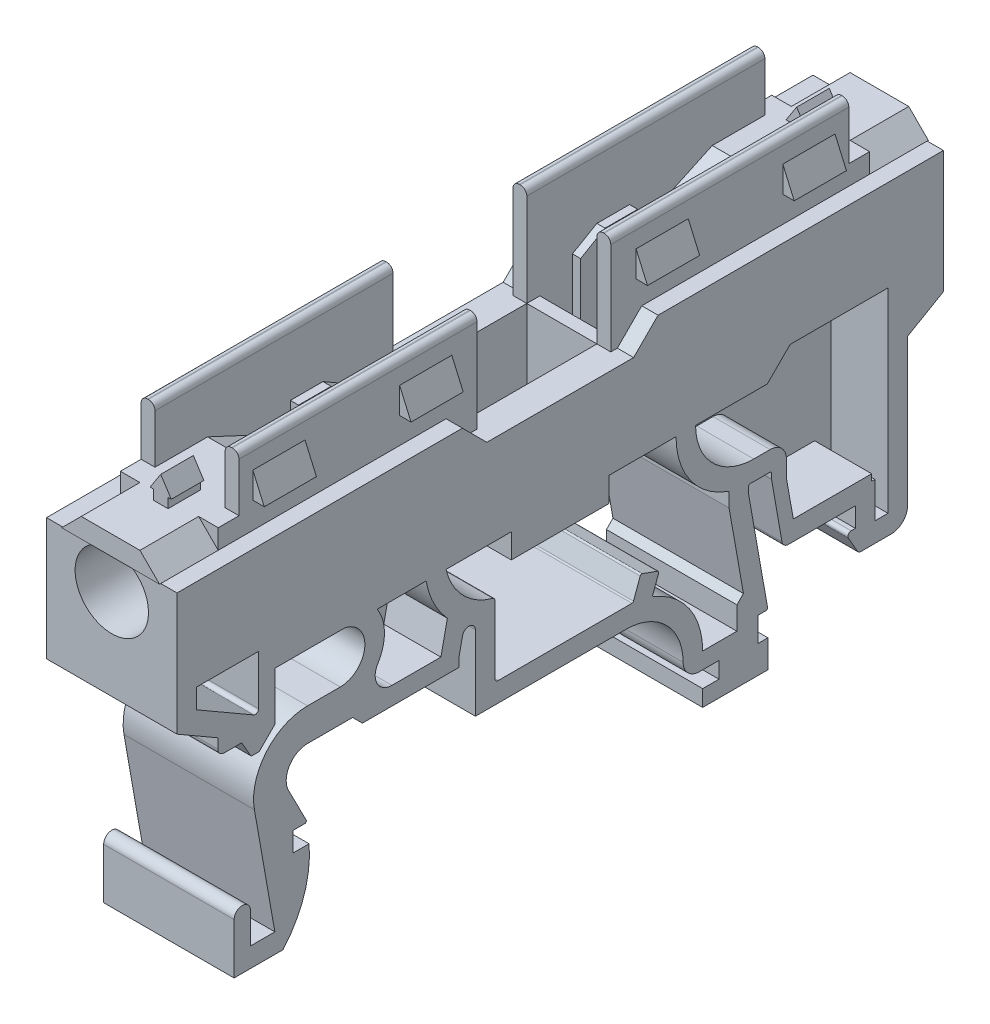
from build123d import *

# Parameters (mm, degrees)
TOPBODY_DEPTH              = 4
MIDBASE_START              = -4
MIDBASES_W                 = 6
MIDBASES_H                 = 1.5
MIDBASE_DEPTH              = 8
REARLEG_START              = -4
REARLEG_DEPTH              = 8
LEGJOINT_START             = -4
LEGJOINT_DEPTH             = 8
FRONTLEG_START             = -4
FRONTLEG_DEPTH             = 8
FRONTPOCKET_DEPTH          = 3.5
REARPOCKET_DEPTH           = 3.5
FRONTLEGFILLWALL_DEPTH     = 0.5
MIDPOCKETS_W               = 4.3
MIDPOCKETS_H               = 8.2
MIDPOCKET_DEPTH            = 4.5
LOWERCUTMIDPOCKETS_W       = 4.3
LOWERCUTMIDPOCKETS_H       = 4
LOWERCUTMIDPOCKET_DEPTH    = 1.5
INSERTPOCKETS_W            = 4.3
INSERTPOCKETS_H            = 8
INSERTPOCKET_DEPTH         = 6
INSERTPOCKETEDGES_W        = 4.3
INSERTPOCKETEDGES_H        = 0.4
INSERTPOCKETEDGE_DEPTH     = 1.5
HEADBODY_DEPTH             = 3
INSERTPOCKETENDS_W         = 2.8
INSERTPOCKETENDS_H         = 1
INSERTPOCKETEND_DEPTH      = 5.5
INSERTENDSLANTEDBODY_DEPTH = 3.6
HOLES_R                    = 2.25
HOLE_DEPTH                 = 8
WIREACCESSS_W              = 2.8
WIREACCESSS_H              = 3.52278299
WIREACCESS_DEPTH           = 2.6
LOCKINGWALL_DEPTH          = 0.85
LOCKINGTAB_DEPTH           = 3.2
LOCKINGTABLP_COUNT         = 2
LOCKINGTABLP_PITCH         = 9
LWF_R                      = 0.4
INSIDEWALL_DEPTH           = 0.5
LWHM_COPY_1_DEPTH          = 3.2
LWF_OF_LWHM_R              = 0.4
LWVM_START                 = -18.7
LWVM_DEPTH                 = 14.6
LWVM_START_2               = -10.4
LWVM_2_OUTLINE_W           = 0.5
LWVM_2_OUTLINE_H           = 6.6
LWVM_2_DEPTH               = 2
LWVM_START_3               = -17.85
LWVM_3_DEPTH               = 3.2
LWVM_START_4               = -8.85
LWVM_4_DEPTH               = 3.2
LWVM_START_5               = -2.232671
LWVM_5_DEPTH               = 0.582671
LWVM_START_6               = 1.65
LWVM_6_DEPTH               = 0.582671
LWVM_START_7               = -3
LWVM_7_DEPTH               = 0.85
LWVM_START_8               = 2.15
LWVM_8_DEPTH               = 0.85
TOPTAB_DEPTH               = 2


with BuildPart() as part:
    # TopBodyS → TopBody (new, symmetric)
    with BuildSketch(Plane(origin=(0, 0, 0), x_dir=(0, 0, -1), z_dir=(1, 0, 0))):
        with BuildLine():
            Line((-23.5, 1.5), (-6, 1.5))
            Line((-6, 1.5), (-4.5, 0))
            Line((-4.5, 0), (4.5, 0))
            Line((4.5, 0), (6, 1.5))
            Line((6, 1.5), (23.5, 1.5))
            Line((23.5, 1.5), (23.5, -5.942264973))
            ThreePointArc((23.5, -5.942264973), (23.48660254, -5.992264973), (23.45, -6.028867513))
            Line((23.45, -6.028867513), (21.3, -7.270170592))
            Line((21.3, -7.270170592), (21.3, -16.270170592))
            ThreePointArc((21.3, -16.270170592), (21.007106781, -16.977277373), (20.3, -17.270170592))
            Line((20.3, -17.270170592), (18.415470054, -17.270170592))
            ThreePointArc((18.415470054, -17.270170592), (18.315470054, -17.243375673), (18.242264973, -17.170170592))
            Line((18.242264973, -17.170170592), (17.664914704, -16.170170592))
            ThreePointArc((17.664914704, -16.170170592), (17.664914704, -15.970170592), (17.838119785, -15.870170592))
            Line((17.838119785, -15.870170592), (18.1, -15.870170592))
            Line((18.1, -15.870170592), (18.1, -14.670170592))
            Line((18.1, -14.670170592), (13.993923101, -14.670170592))
            ThreePointArc((13.993923101, -14.670170592), (13.736808057, -14.576588369), (13.6, -14.339629863))
            Line((13.6, -14.339629863), (12.959099098, -10.704900228))
            ThreePointArc((12.959099098, -10.704900228), (12.956821709, -10.687601741), (12.956060648, -10.670170592))
            Line((12.956060648, -10.670170592), (12.956060648, -10.370170592))
            ThreePointArc((12.956060648, -10.370170592), (12.926771326, -10.299459914), (12.856060648, -10.270170592))
            Line((12.856060648, -10.270170592), (11.870170592, -10.270170592))
            ThreePointArc((11.870170592, -10.270170592), (8.497150619, -8.873019973), (7.1, -5.5))
            Line((7.1, -5.5), (-17.5, -5.5))
            Line((-17.5, -5.5), (-17.5, -8.443375673))
            ThreePointArc((-17.5, -8.443375673), (-17.507612047, -8.481644016), (-17.529289322, -8.514086351))
            Line((-17.529289322, -8.514086351), (-18.429289322, -9.414086351))
            ThreePointArc((-18.429289322, -9.414086351), (-18.461731657, -9.435763626), (-18.5, -9.443375673))
            Line((-18.5, -9.443375673), (-18.9, -9.443375673))
            ThreePointArc((-18.9, -9.443375673), (-18.95, -9.429978213), (-18.98660254, -9.393375673))
            Line((-18.98660254, -9.393375673), (-19.506217783, -8.493375673))
            ThreePointArc((-19.506217783, -8.493375673), (-19.542820323, -8.456773133), (-19.592820323, -8.443375673))
            Line((-19.592820323, -8.443375673), (-20.6, -8.443375673))
            ThreePointArc((-20.6, -8.443375673), (-20.882842712, -8.326218385), (-21, -8.043375673))
            Line((-21, -8.043375673), (-21, -7.443375673))
            Line((-21, -7.443375673), (-23.5, -6))
            Line((-23.5, -6), (-23.5, 1.5))
        make_face()
    extrude(amount=TOPBODY_DEPTH, both=True)

    # MidBaseS → MidBase (add)
    with BuildSketch(Plane(origin=(0, 0, 0), x_dir=(0, 0, -1), z_dir=(1, 0, 0)).offset(MIDBASE_START)):
        with Locations((0, -6.25)):
            Rectangle(MIDBASES_W, MIDBASES_H)
    extrude(amount=MIDBASE_DEPTH)

    # RearLegS → RearLeg (add)
    with BuildSketch(Plane(origin=(0, 0, 0), x_dir=(0, 0, -1), z_dir=(1, 0, 0)).offset(REARLEG_START)):
        with BuildLine():
            Line((11.556060648, -10.810152454), (12.714966684, -17.382635182))
            ThreePointArc((12.714966684, -17.382635182), (12.693090353, -17.464278761), (12.616485908, -17.5))
            Line((12.616485908, -17.5), (12.135661267, -17.5))
            Line((12.135661267, -17.5), (12.135661267, -19))
            Line((12.135661267, -19), (12.735661267, -19))
            Line((12.735661267, -19), (12.735661267, -20.7))
            Line((12.735661267, -20.7), (8.735661267, -20.7))
            Line((8.735661267, -20.7), (8.735661267, -19.7))
            Line((8.735661267, -19.7), (9.735661267, -19.7))
            Line((9.735661267, -19.7), (9.735661267, -18.7))
            Line((9.735661267, -18.7), (8.735661267, -18.7))
            Line((8.735661267, -18.7), (8.735661267, -17.7))
            Line((8.735661267, -17.7), (10.835026164, -17.7))
            Line((10.835026164, -17.7), (10.835026164, -16.3))
            Line((10.835026164, -16.3), (11.235026164, -15.9))
            Line((11.235026164, -15.9), (10.356060648, -10.91513885))
            Line((10.356060648, -10.91513885), (10.356060648, -10.09491139))
            ThreePointArc((10.356060648, -10.09491139), (10.337651941, -10.037093911), (10.289203429, -10.000563332))
            ThreePointArc((10.289203429, -10.000563332), (10.962919155, -10.183099648), (11.656060648, -10.265362988))
            ThreePointArc((11.656060648, -10.265362988), (11.58534997, -10.29465231), (11.556060648, -10.365362988))
            Line((11.556060648, -10.365362988), (11.556060648, -10.810152454))
        make_face()
    extrude(amount=REARLEG_DEPTH)

    # LegJointS → LegJoint (add)
    with BuildSketch(Plane(origin=(0, 0, 0), x_dir=(0, 0, -1), z_dir=(1, 0, 0)).offset(LEGJOINT_START)):
        with BuildLine():
            Line((-4, -8.656042918), (-4, -12.8))
            ThreePointArc((-4, -12.8), (-3.941421356, -12.941421356), (-3.8, -13))
            Line((-3.8, -13), (4.399287288, -13))
            ThreePointArc((4.399287288, -13), (4.456644931, -12.981915204), (4.49325655, -12.934202014))
            Line((4.49325655, -12.934202014), (4.905743356, -11.800903829))
            ThreePointArc((4.905743356, -11.800903829), (4.957450792, -11.744475065), (5.033914632, -11.741136582))
            Line((5.033914632, -11.741136582), (5.973607253, -12.083156725))
            ThreePointArc((5.973607253, -12.083156725), (6.030036017, -12.134864161), (6.033374501, -12.211328001))
            Line((6.033374501, -12.211328001), (5.677001646, -13.190454373))
            ThreePointArc((5.677001646, -13.190454373), (5.679904796, -13.265971798), (5.734818624, -13.317892713))
            ThreePointArc((5.734818624, -13.317892713), (7.913549841, -15.044443521), (8.735661267, -17.7))
            Line((8.735661267, -17.7), (8.735661267, -18.7))
            Line((8.735661267, -18.7), (8.535661267, -18.7))
            ThreePointArc((8.535661267, -18.7), (7.828554486, -18.407106781), (7.535661267, -17.7))
            ThreePointArc((7.535661267, -17.7), (6.510535002, -15.225126266), (4.035661267, -14.2))
            Line((4.035661267, -14.2), (-5.2, -14.2))
            Line((-5.2, -14.2), (-5.2, -9.614111458))
            ThreePointArc((-5.2, -9.614111458), (-5.259875742, -9.403599014), (-5.421577446, -9.256109513))
            ThreePointArc((-5.421577446, -9.256109513), (-7.269893266, -7.711644965), (-8.223973273, -5.5))
            Line((-8.223973273, -5.5), (-7, -5.5))
            ThreePointArc((-7, -5.5), (-5.983838809, -7.376158966), (-4.147718297, -8.462997267))
            ThreePointArc((-4.147718297, -8.462997267), (-4.041166218, -8.534503502), (-4, -8.656042918))
        make_face()
    extrude(amount=LEGJOINT_DEPTH)

    # FrontLegS → FrontLeg (add)
    with BuildSketch(Plane(origin=(0, 0, 0), x_dir=(0, 0, -1), z_dir=(1, 0, 0)).offset(FRONTLEG_START)):
        with BuildLine():
            Line((-13.491109447, -8.5), (-15.491109447, -8.5))
            ThreePointArc((-15.491109447, -8.5), (-18.029148187, -9.683506901), (-18.753949156, -12.388500946))
            Line((-18.753949156, -12.388500946), (-17.5, -19.5))
            Line((-17.5, -19.5), (-19, -19.5))
            Line((-19, -19.5), (-19, -17.6))
            ThreePointArc((-19, -17.6), (-19.5, -17.1), (-20, -17.6))
            Line((-20, -17.6), (-20, -20.7))
            Line((-20, -20.7), (-17, -20.7))
            ThreePointArc((-17, -20.7), (-15.70779225, -18.448141241), (-15.4, -15.870170592))
            Line((-15.4, -15.870170592), (-16.4, -15.870170592))
            Line((-16.4, -15.870170592), (-16.4, -14.670170592))
            Line((-16.4, -14.670170592), (-15.666299562, -14.670170592))
            ThreePointArc((-15.666299562, -14.670170592), (-15.580975896, -14.622322984), (-15.577302897, -14.524568032))
            Line((-15.577302897, -14.524568032), (-16.659790762, -12.412015361))
            ThreePointArc((-16.659790762, -12.412015361), (-16.611557879, -11.128322479), (-15.491109447, -10.5))
            Line((-15.491109447, -10.5), (-12.732074565, -10.5))
            Line((-12.732074565, -10.5), (-12.132074565, -11.1))
            Line((-12.132074565, -11.1), (-6.2, -11.1))
            Line((-6.2, -11.1), (-6.2, -10.5))
            Line((-6.2, -10.5), (-5.991031027, -9.529881204))
            ThreePointArc((-5.991031027, -9.529881204), (-5.773315681, -9.253609482), (-5.421577446, -9.256109513))
            ThreePointArc((-5.421577446, -9.256109513), (-6.220620651, -8.763181527), (-6.918006023, -8.134610379))
            Line((-6.918006023, -8.134610379), (-7.319317373, -9.997660568))
            Line((-7.319317373, -9.997660568), (-10.319317373, -9.997660568))
            ThreePointArc((-10.319317373, -9.997660568), (-11.218405008, -9.468085144), (-11.191161904, -8.424980875))
            ThreePointArc((-11.191161904, -8.424980875), (-10.779386434, -6.957687257), (-11.223973273, -5.5))
            Line((-11.223973273, -5.5), (-13.223973273, -5.5))
            ThreePointArc((-13.223973273, -5.5), (-11.985174377, -7.122202955), (-13.491109447, -8.5))
        make_face()
    extrude(amount=FRONTLEG_DEPTH)

    # FrontPocketS → FrontPocket (cut)
    with BuildSketch(Plane(origin=(4, 0, 0), x_dir=(0, 0, -1), z_dir=(1, 0, 0))):
        with BuildLine():
            Line((-22.3, -4.1), (-18.5, -4.1))
            Line((-18.5, -4.1), (-18.5, -7.154700538))
            ThreePointArc((-18.5, -7.154700538), (-18.6, -7.327905619), (-18.8, -7.327905619))
            Line((-18.8, -7.327905619), (-22.3, -5.307179677))
            Line((-22.3, -5.307179677), (-22.3, -4.1))
        make_face()
    frontpocket = extrude(amount=-FRONTPOCKET_DEPTH, mode=Mode.SUBTRACT)

    # RearPocketS → RearPocket (cut)
    with BuildSketch(Plane(origin=(4, 0, 0), x_dir=(0, 0, -1), z_dir=(1, 0, 0))):
        with BuildLine():
            Line((8.3, -5.5), (12.7, -5.5))
            Line((12.7, -5.5), (14.1, -4.1))
            Line((14.1, -4.1), (20.1, -4.1))
            Line((20.1, -4.1), (20.1, -16.070170592))
            Line((20.1, -16.070170592), (19.3, -16.070170592))
            Line((19.3, -16.070170592), (19.3, -13.870170592))
            Line((19.3, -13.870170592), (19.1, -13.870170592))
            Line((19.1, -13.870170592), (19.1, -13.470170592))
            Line((19.1, -13.470170592), (14.293355346, -13.470170592))
            Line((14.293355346, -13.470170592), (13.870170592, -11.070170592))
            Line((13.870170592, -11.070170592), (13.870170592, -10.070170592))
            ThreePointArc((13.870170592, -10.070170592), (13.577277373, -9.363063811), (12.870170592, -9.070170592))
            Line((12.870170592, -9.070170592), (11.870170592, -9.070170592))
            ThreePointArc((11.870170592, -9.070170592), (9.345678756, -8.024491836), (8.3, -5.5))
        make_face()
    rearpocket = extrude(amount=-REARPOCKET_DEPTH, mode=Mode.SUBTRACT)

    # Mirror1: FrontPocket, RearPocket across plane
    add(frontpocket.mirror(Plane(origin=(0, 0, 0), x_dir=(0, 0, 1), z_dir=(1, 0, 0))), mode=Mode.SUBTRACT)
    add(rearpocket.mirror(Plane(origin=(0, 0, 0), x_dir=(0, 0, 1), z_dir=(1, 0, 0))), mode=Mode.SUBTRACT)

    # FrontLegFillWallS → FrontLegFillWall (add, symmetric)
    with BuildSketch(Plane(origin=(0, 0, 0), x_dir=(0, 0, -1), z_dir=(1, 0, 0))):
        with BuildLine():
            Line((-7.319317373, -9.997660568), (-10.319317373, -9.997660568))
            ThreePointArc((-10.319317373, -9.997660568), (-11.218405008, -9.468085144), (-11.191161904, -8.424980875))
            ThreePointArc((-11.191161904, -8.424980875), (-10.779386434, -6.957687257), (-11.223973273, -5.5))
            Line((-11.223973273, -5.5), (-8.223973273, -5.5))
            ThreePointArc((-8.223973273, -5.5), (-7.761097924, -6.911541204), (-6.918006023, -8.134610379))
            Line((-6.918006023, -8.134610379), (-7.319317373, -9.997660568))
        make_face()
    extrude(amount=FRONTLEGFILLWALL_DEPTH, both=True)

    # MidPocketS → MidPocket (cut)
    with BuildSketch(Plane(origin=(0, 0, 0), x_dir=(1, 0, 0), z_dir=(0, 1, 0))):
        Rectangle(MIDPOCKETS_W, MIDPOCKETS_H)
    extrude(amount=-MIDPOCKET_DEPTH, mode=Mode.SUBTRACT)

    # LowerCutMidPocketS → LowerCutMidPocket (cut)
    with BuildSketch(Plane(origin=(0, -4.5, 0), x_dir=(1, 0, 0), z_dir=(0, 1, 0))):
        Rectangle(LOWERCUTMIDPOCKETS_W, LOWERCUTMIDPOCKETS_H)
    extrude(amount=-LOWERCUTMIDPOCKET_DEPTH, mode=Mode.SUBTRACT)

    # InsertPocketS → InsertPocket (cut)
    with BuildSketch(Plane(origin=(0, 1.5, 0), x_dir=(1, 0, 0), z_dir=(0, 1, 0))):
        with Locations((0, -8.9)):
            Rectangle(INSERTPOCKETS_W, INSERTPOCKETS_H)
    insertpocket = extrude(amount=-INSERTPOCKET_DEPTH, mode=Mode.SUBTRACT)

    # InsertPocketEdgeS → InsertPocketEdge (cut)
    with BuildSketch(Plane(origin=(0, 1.5, 0), x_dir=(1, 0, 0), z_dir=(0, 1, 0))):
        with Locations((0, -4.7)):
            Rectangle(INSERTPOCKETEDGES_W, INSERTPOCKETEDGES_H)
    insertpocketedge = extrude(amount=-INSERTPOCKETEDGE_DEPTH, mode=Mode.SUBTRACT)

    # HeadBodyS → HeadBody (add, symmetric)
    with BuildSketch(Plane(origin=(0, 0, 0), x_dir=(0, 0, -1), z_dir=(1, 0, 0))):
        Polygon((-12.9, 1.5), (-15.473408305, 2.7), (-19.973408305, 2.7), (-19.973408305, 1.5), align=None)
    headbody = extrude(amount=HEADBODY_DEPTH, both=True)

    # InsertPocketEndS → InsertPocketEnd (cut)
    with BuildSketch(Plane(origin=(0, 2.7, 0), x_dir=(1, 0, 0), z_dir=(0, 1, 0))):
        with Locations((0, -13.4)):
            Rectangle(INSERTPOCKETENDS_W, INSERTPOCKETENDS_H)
    insertpocketend = extrude(amount=-INSERTPOCKETEND_DEPTH, mode=Mode.SUBTRACT)

    # InsertEndSlantedBodyS → InsertEndSlantedBody (add)
    with BuildSketch(Plane.XY.offset(19.973408305)):
        Polygon((3, 1.5), (-3, 1.5), (-1.8, 2.7), (1.8, 2.7), align=None)
    insertendslantedbody = extrude(amount=INSERTENDSLANTEDBODY_DEPTH)

    # HoleS → Hole (cut)
    with BuildSketch(Plane.XY.offset(23.5)):
        with Locations((0, -0.416846171)):
            Circle(HOLES_R)
    hole = extrude(amount=-HOLE_DEPTH, mode=Mode.SUBTRACT)

    # WireAccessS → WireAccess (cut)
    with BuildSketch(Plane(origin=(0, 0, 13.9), x_dir=(-1, 0, 0), z_dir=(0, 0, -1))):
        with Locations((0, -0.416846171)):
            Rectangle(WIREACCESSS_W, WIREACCESSS_H)
    wireaccess = extrude(amount=-WIREACCESS_DEPTH, mode=Mode.SUBTRACT)

    # IPHM: InsertPocket, InsertPocketEdge, HeadBody, InsertPocketEnd across plane
    add(insertpocket.mirror(Plane.XY), mode=Mode.SUBTRACT)
    add(insertpocketedge.mirror(Plane.XY), mode=Mode.SUBTRACT)
    add(headbody.mirror(Plane.XY))
    add(insertpocketend.mirror(Plane.XY), mode=Mode.SUBTRACT)

    # WiresAccessHM: InsertEndSlantedBody, Hole, WireAccess across plane
    add(insertendslantedbody.mirror(Plane.XY))
    add(hole.mirror(Plane.XY), mode=Mode.SUBTRACT)
    add(wireaccess.mirror(Plane.XY), mode=Mode.SUBTRACT)

    # LockingWallS → LockingWall (add)
    with BuildSketch(Plane.ZY.offset(-2.15)):
        Polygon((4.1, 0), (4.1, 6.1), (18.7, 6.1), (18.7, 1.5), (6, 1.5), (4.5, 0), align=None)
    lockingwall = extrude(amount=-LOCKINGWALL_DEPTH)

    # LockingTabS → LockingTab (add)
    with BuildSketch(Plane.XY.offset(17.85)):
        Polygon((3, 3.1), (3.7, 3.1), (3, 4.7), align=None)
    lockingtab = extrude(amount=-LOCKINGTAB_DEPTH)

    # LockingTabLP: LockingTab ×2
    with Locations(*[(0, 0, -i * LOCKINGTABLP_PITCH) for i in range(1, LOCKINGTABLP_COUNT)]):
        add(lockingtab)

    # LWF
    lwf_edges = [part.edges().sort_by_distance(p)[0] for p in [
        (2.15, 6.1, 11.4),
        (3, 6.1, 11.4),
    ]]
    fillet(lwf_edges, radius=LWF_R)

    # InsideWallS → InsideWall (add)
    with BuildSketch(Plane.ZY.offset(-2.15)):
        Polygon((6.9, -4.5), (10.4, -4.5), (10.4, 2.1), (8.4, 2.1), (6.9, 1.233974596), align=None)
    insidewall = extrude(amount=INSIDEWALL_DEPTH)

    # LWHM: LockingWall, LockingTab, InsideWall across plane
    add(lockingwall.mirror(Plane(origin=(0, 0, 0), x_dir=(0, 0, 1), z_dir=(1, 0, 0))))
    add(lockingtab.mirror(Plane(origin=(0, 0, 0), x_dir=(0, 0, 1), z_dir=(1, 0, 0))))
    add(insidewall.mirror(Plane(origin=(0, 0, 0), x_dir=(0, 0, 1), z_dir=(1, 0, 0))))

    # LWHM copy 1 sketch → LWHM copy 1 (add)
    with BuildSketch(Plane(origin=(0, 0, 8.85), x_dir=(-1, 0, 0), z_dir=(0, 0, 1))):
        Polygon((3, -3.1), (3.7, -3.1), (3, -4.7), align=None)
    extrude(amount=-LWHM_COPY_1_DEPTH)

    # LWF of LWHM
    lwf_of_lwhm_edges = [part.edges().sort_by_distance(p)[0] for p in [
        (-2.15, 6.1, 11.4),
        (-3, 6.1, 11.4),
    ]]
    fillet(lwf_of_lwhm_edges, radius=LWF_OF_LWHM_R)

    # LWVM: read off the stored shape, not the designer's step
    # LWVM outline → LWVM (add)
    with BuildSketch(Plane.XY.offset(LWVM_START)):
        with BuildLine():
            Line((-3, 1.5), (-2.15, 1.5))
            Line((-2.15, 1.5), (-2.15, 5.7))
            ThreePointArc((-2.15, 5.7), (-2.267157288, 5.982842712), (-2.55, 6.1))
            Line((-2.55, 6.1), (-2.6, 6.1))
            ThreePointArc((-2.6, 6.1), (-2.882842712, 5.982842712), (-3, 5.7))
            Line((-3, 5.7), (-3, 1.5))
        make_face()
        with BuildLine():
            Line((3, 1.5), (3, 5.7))
            ThreePointArc((3, 5.7), (2.882842712, 5.982842712), (2.6, 6.1))
            Line((2.6, 6.1), (2.55, 6.1))
            ThreePointArc((2.55, 6.1), (2.267157288, 5.982842712), (2.15, 5.7))
            Line((2.15, 5.7), (2.15, 1.5))
            Line((2.15, 1.5), (3, 1.5))
        make_face()
    extrude(amount=LWVM_DEPTH)

    # LWVM 2 outline → LWVM 2 (add)
    with BuildSketch(Plane.XY.offset(LWVM_START_2)):
        with Locations((-1.9, -1.2)):
            Rectangle(LWVM_2_OUTLINE_W, LWVM_2_OUTLINE_H)
        with Locations((1.9, -1.2)):
            Rectangle(LWVM_2_OUTLINE_W, LWVM_2_OUTLINE_H)
    extrude(amount=LWVM_2_DEPTH)

    # LWVM 3 outline → LWVM 3 (add)
    with BuildSketch(Plane.XY.offset(LWVM_START_3)):
        Polygon((-3.7, 3.1), (-3, 3.1), (-3, 4.7), align=None)
        Polygon((3, 4.7), (3, 3.1), (3.7, 3.1), align=None)
    extrude(amount=LWVM_3_DEPTH)

    # LWVM 4 outline → LWVM 4 (add)
    with BuildSketch(Plane.XY.offset(LWVM_START_4)):
        Polygon((-3.7, 3.1), (-3, 3.1), (-3, 4.7), align=None)
        Polygon((3, 4.7), (3, 3.1), (3.7, 3.1), align=None)
    extrude(amount=LWVM_4_DEPTH)

    # LWVM 5 outline → LWVM 5 (add)
    with BuildSketch(Plane.YZ.offset(LWVM_START_5)):
        Polygon((1.233974596, -6.9), (-4.5, -6.9), (-4.5, -8.4), (2.1, -8.4), align=None)
    extrude(amount=LWVM_5_DEPTH)

    # LWVM 6 outline → LWVM 6 (add)
    with BuildSketch(Plane.YZ.offset(LWVM_START_6)):
        Polygon((1.233974596, -6.9), (-4.5, -6.9), (-4.5, -8.4), (2.1, -8.4), align=None)
    extrude(amount=LWVM_6_DEPTH)

    # LWVM 7 outline → LWVM 7 (add)
    with BuildSketch(Plane.YZ.offset(LWVM_START_7)):
        Polygon((1.5, -4.1), (0, -4.1), (0, -4.5), (1.5, -6), align=None)
    extrude(amount=LWVM_7_DEPTH)

    # LWVM 8 outline → LWVM 8 (add)
    with BuildSketch(Plane.YZ.offset(LWVM_START_8)):
        Polygon((1.5, -4.1), (0, -4.1), (0, -4.5), (1.5, -6), align=None)
    extrude(amount=LWVM_8_DEPTH)

    # TopTabS → TopTab (add)
    with BuildSketch(Plane.XY.offset(20.5)):
        Polygon((-0.45, 2.7), (0.45, 2.7), (0.45, 3.3), (0.65, 3.3), (0, 4.3), (-0.65, 3.3), (-0.45, 3.3), align=None)
    toptab = extrude(amount=-TOPTAB_DEPTH)

    # TTHM: TopTab across plane
    add(toptab.mirror(Plane.XY))


solid = part.part
